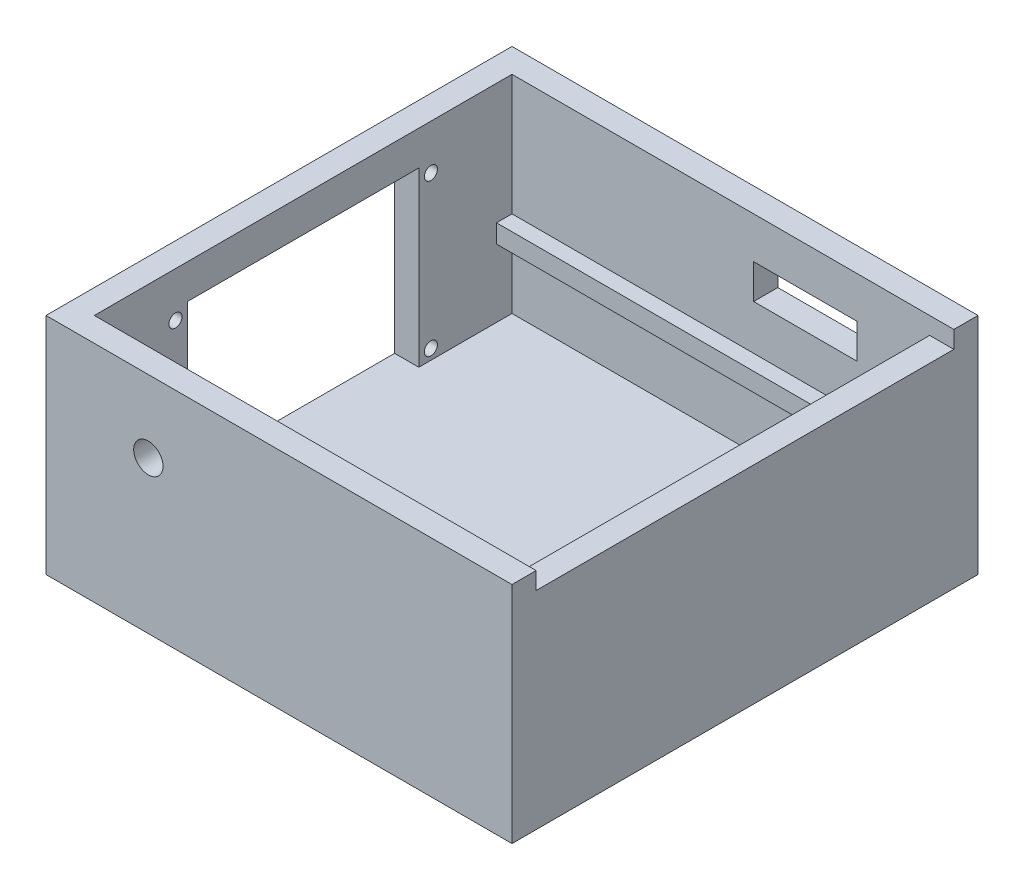
from build123d import *

# Parameters (mm, degrees)
SKETCH2_W           = 135
SKETCH2_H           = 135
SKETCH2_W_2         = 121
SKETCH2_H_2         = 121
BOSS_EXTRUDE1_DEPTH = 65
SKETCH2_2_W         = 121
SKETCH2_2_H         = 121
BOSS_EXTRUDE2_DEPTH = 5
SKETCH3_W           = 121
SKETCH3_H           = 5.333672831
BOSS_EXTRUDE3_DEPTH = 4.5
SKETCH3_3_W         = 30
SKETCH3_3_H         = 10
CUT_EXTRUDE1_DEPTH  = 159.635588693
SKETCH10_R          = 4.25
CUT_EXTRUDE2_DEPTH  = 26.5
SKETCH11_R          = 1.9
SKETCH11_W          = 67
SKETCH11_H          = 50
CUT_EXTRUDE3_DEPTH  = 26.5
SKETCH12_W          = 7
SKETCH12_H          = 121
CUT_EXTRUDE4_DEPTH  = 5


with BuildPart() as part:
    # Sketch2 → Boss-Extrude1 (new body)
    with BuildSketch(Plane(origin=(0, 0, 0), x_dir=(1, 0, 0), z_dir=(0, 1, 0))):
        Rectangle(SKETCH2_W, SKETCH2_H)
        Rectangle(SKETCH2_W_2, SKETCH2_H_2, mode=Mode.SUBTRACT)
    extrude(amount=BOSS_EXTRUDE1_DEPTH)

    # Sketch2<2> → Boss-Extrude2 (add)
    with BuildSketch(Plane(origin=(0, 0, 0), x_dir=(1, 0, 0), z_dir=(0, 1, 0))):
        Rectangle(SKETCH2_2_W, SKETCH2_2_H)
    extrude(amount=BOSS_EXTRUDE2_DEPTH)

    # Sketch3 → Boss-Extrude3 (add)
    with BuildSketch(Plane.XY.offset(-60.5)):
        with Locations((0, 27.333163585)):
            Rectangle(SKETCH3_W, SKETCH3_H)
    extrude(amount=BOSS_EXTRUDE3_DEPTH)

    # Sketch3<3> → Cut-Extrude1 (cut, through all)
    with BuildSketch(Plane.XY.offset(-60.5)):
        with Locations((24.5, 48)):
            Rectangle(SKETCH3_3_W, SKETCH3_3_H)
    extrude(amount=-CUT_EXTRUDE1_DEPTH, mode=Mode.SUBTRACT)

    # Sketch10 → Cut-Extrude2 (cut)
    with BuildSketch(Plane.XY.offset(67.5)):
        with Locations((-37.851358132, 44.08314266)):
            Circle(SKETCH10_R)
    extrude(amount=-CUT_EXTRUDE2_DEPTH, mode=Mode.SUBTRACT)

    # Sketch11 → Cut-Extrude3 (cut)
    with BuildSketch(Plane.ZY.offset(67.5)):
        with Locations((-37, 52)):
            Circle(SKETCH11_R)
        with Locations((37, 52)):
            Circle(SKETCH11_R)
        with Locations((37, 8)):
            Circle(SKETCH11_R)
        with Locations((-37, 8)):
            Circle(SKETCH11_R)
        with Locations((0, 30)):
            Rectangle(SKETCH11_W, SKETCH11_H)
    extrude(amount=-CUT_EXTRUDE3_DEPTH, mode=Mode.SUBTRACT)

    # Sketch12 → Cut-Extrude4 (cut)
    with BuildSketch(Plane(origin=(0, 65, 0), x_dir=(1, 0, 0), z_dir=(0, 1, 0))):
        with Locations((64, 0)):
            Rectangle(SKETCH12_W, SKETCH12_H)
    extrude(amount=-CUT_EXTRUDE4_DEPTH, mode=Mode.SUBTRACT)


solid = part.part
